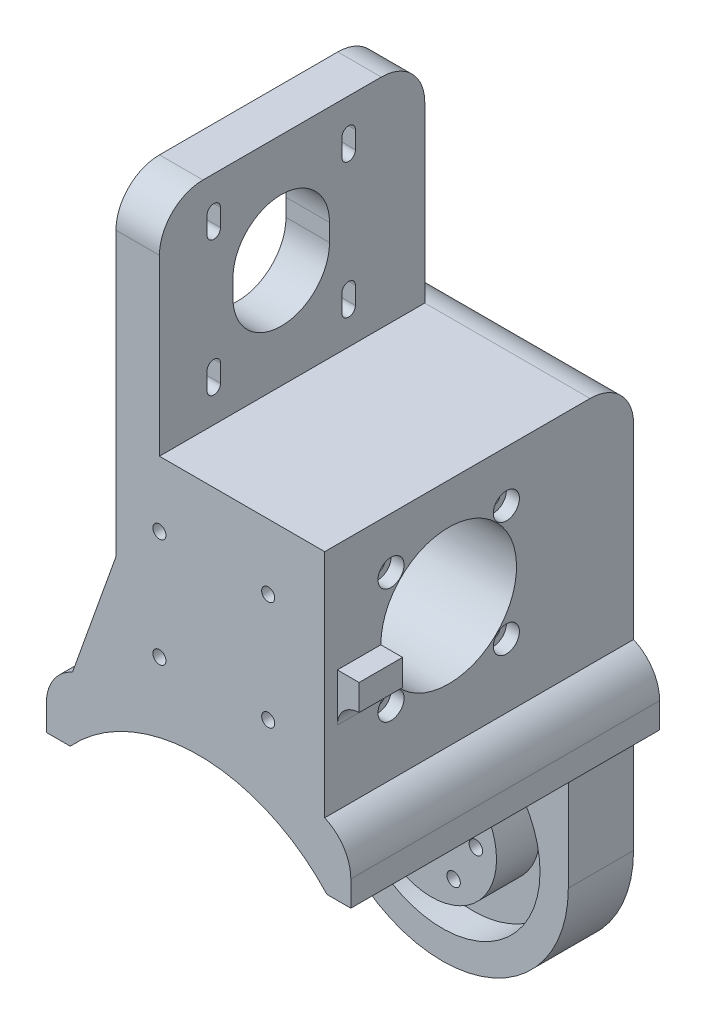
from build123d import *

# Parameters (mm, degrees)
SKETCH_1_R           = 29
EXTRUDE_1_DEPTH      = 15
SKETCH_2_R           = 1.55
SKETCH_2_R_2         = 5.1
CUT_EXTRUDE_1_DEPTH  = 44.669211122
EXTRUDE_2_DEPTH      = 71
SKETCH_12_W          = 70
SKETCH_12_H          = 15
EXTRUDE_3_DEPTH      = 71
FILLET_5_R           = 10
SKETCH_22_W          = 71
SKETCH_22_H          = 103
CUT_EXTRUDE_11_DEPTH = 10
SKETCH_4_R           = 40
CUT_EXTRUDE_2_DEPTH  = 56
SKETCH_5_R           = 15.6
SKETCH_5_R_2         = 1.55
CUT_EXTRUDE_3_DEPTH  = 171.241005636
SKETCH_6_W           = 32.2
SKETCH_6_H           = 32.2
CUT_EXTRUDE_4_DEPTH  = 23.7
CUT_EXTRUDE_5_DEPTH  = 171.241005636
SKETCH_8_W           = 10
SKETCH_8_H           = 50
CUT_EXTRUDE_6_DEPTH  = 10
FILLET_1_R           = 10
FILLET_2_R           = 10
FILLET_3_R           = 10
SKETCH_17_R          = 22.5
CUT_EXTRUDE_7_DEPTH  = 7
SKETCH_18_R          = 24
CUT_EXTRUDE_8_DEPTH  = 0.5
EXTRUDE_START        = 10
SKETCH_19_R          = 15
SKETCH_19_R_2        = 1.55
SKETCH_19_R_3        = 5.1
EXTRUDE_5_DEPTH      = 10
SKETCH_20_R          = 3
CUT_EXTRUDE_9_DEPTH  = 3
SKETCH_23_R          = 1.5
CUT_EXTRUDE_12_DEPTH = 161.262160225
SKETCH_27_R          = 3
CUT_EXTRUDE_14_DEPTH = 3
SKETCH_28_W          = 10
SKETCH_28_H          = 6
EXTRUDE_6_DEPTH      = 5
FILLET_6_R           = 5
EXTRUDE_7_DEPTH      = 10
EXTRUDE_8_DEPTH      = 6


# Some blends are built 0.0001 mm under size
with BuildPart() as part:
    # 草图1 → 凸台-拉伸1 (new body)
    with BuildSketch(Plane.XY):
        Circle(SKETCH_1_R)
    extrude(amount=EXTRUDE_1_DEPTH)

    # 草图2 → 切除-拉伸1 (cut, through all)
    with BuildSketch(Plane.XY.offset(15)):
        with Locations((-5.125, 8.876760389)):
            Circle(SKETCH_2_R)
        with Locations((5.125, 8.876760389)):
            Circle(SKETCH_2_R)
        with Locations((10.25, 0)):
            Circle(SKETCH_2_R)
        with Locations((5.125, -8.876760389)):
            Circle(SKETCH_2_R)
        Circle(SKETCH_2_R_2)
        with Locations((-5.125, -8.876760389)):
            Circle(SKETCH_2_R)
        with Locations((-10.25, 0)):
            Circle(SKETCH_2_R)
    extrude(amount=-CUT_EXTRUDE_1_DEPTH, mode=Mode.SUBTRACT)

    # 草图17 → 切除-拉伸7 (cut)
    with BuildSketch(Plane.XY.offset(15)):
        Circle(SKETCH_17_R)
    extrude(amount=-CUT_EXTRUDE_7_DEPTH, mode=Mode.SUBTRACT)

    # 草图18 → 切除-拉伸8 (cut)
    with BuildSketch(Plane.XY.offset(8)):
        Circle(SKETCH_18_R)
    extrude(amount=-CUT_EXTRUDE_8_DEPTH, mode=Mode.SUBTRACT)


with BuildPart() as body_2:
    # 草图3 → 凸台-拉伸2 (new body)
    with BuildSketch(Plane.XY):
        with BuildLine():
            ThreePointArc((-29, 0), (0, 29), (29, 0))
            Line((29, 0), (29, 95))
            Line((29, 95), (-9, 95))
            Line((-9, 95), (-9, 145))
            Line((-9, 145), (-29, 145))
            Line((-29, 145), (-29, 0))
        make_face()
    extrude(amount=EXTRUDE_2_DEPTH)

    # 草图12 → 凸台-拉伸3 (add)
    with BuildSketch(Plane.XY.offset(71)):
        with Locations((0, 34.5)):
            Rectangle(SKETCH_12_W, SKETCH_12_H)
    extrude(amount=-EXTRUDE_3_DEPTH)

    # 圆角5
    # the kernel refuses this fillet: 10 mm, written as the material it takes off along each edge
    with BuildSketch(Plane(origin=(35, 42, 93.912878475), x_dir=(0, -1, 0), z_dir=(0, 0, -1))) as fillet_5_piece_1:
        with BuildLine():
            CenterArc((9.16515139, 10), FILLET_5_R, 203.578178478, 66.421821522)
            Line((0, 6), (-0.183303028, 5.92))
            ThreePointArc((-0.183303028, 5.92), (-0.2, 3), (-0.2, 0))
            Line((-0.2, 0), (0, -0.2))
            Line((0, -0.2), (9.16515139, -0.2))
            Line((9.16515139, -0.2), (9.16515139, 0))
        make_face()
    extrude(amount=116.82575695, mode=Mode.SUBTRACT)
    with BuildSketch(Plane(origin=(-35, 42, 93.912878475), x_dir=(0, -1, 0), z_dir=(0, 0, -1))) as fillet_5_piece_2:
        with BuildLine():
            CenterArc((9.16515139, -10), FILLET_5_R, 90, 66.421821522)
            Line((0, -6), (-0.183303028, -5.92))
            ThreePointArc((-0.183303028, -5.92), (-0.2, -3), (-0.2, 0))
            Line((-0.2, 0), (0, 0.2))
            Line((0, 0.2), (9.16515139, 0.2))
            Line((9.16515139, 0.2), (9.16515139, 0))
        make_face()
    extrude(amount=116.82575695, mode=Mode.SUBTRACT)

    # 草图22 → 切除-拉伸11 (cut)
    with BuildSketch(Plane.ZY.offset(29)):
        with Locations((35.5, 93.5)):
            Rectangle(SKETCH_22_W, SKETCH_22_H)
    extrude(amount=-CUT_EXTRUDE_11_DEPTH, mode=Mode.SUBTRACT)

    # 草图4 → 切除-拉伸2 (cut)
    with BuildSketch(Plane.XY.offset(71)):
        Circle(SKETCH_4_R)
    extrude(amount=-CUT_EXTRUDE_2_DEPTH, mode=Mode.SUBTRACT)

    # 草图5 → 切除-拉伸3 (cut, through all)
    with BuildSketch(Plane.ZY.offset(19)):
        with Locations(Location((42.5, 70, 0), (0, 0, 270))):
            Circle(SKETCH_5_R)
        with Locations(Location((29.241747853, 83.258252147, 0), (0, 0, 270))):
            Circle(SKETCH_5_R_2)
        with Locations(Location((55.758252147, 83.258252147, 0), (0, 0, 270))):
            Circle(SKETCH_5_R_2)
        with Locations(Location((55.758252147, 56.741747853, 0), (0, 0, 270))):
            Circle(SKETCH_5_R_2)
        with Locations(Location((29.241747853, 56.741747853, 0), (0, 0, 270))):
            Circle(SKETCH_5_R_2)
    extrude(amount=-CUT_EXTRUDE_3_DEPTH, mode=Mode.SUBTRACT)

    # 草图6 → 切除-拉伸4 (cut)
    with BuildSketch(Plane.ZY.offset(19)):
        with Locations((42.5, 70)):
            Rectangle(SKETCH_6_W, SKETCH_6_H)
    extrude(amount=-CUT_EXTRUDE_4_DEPTH, mode=Mode.SUBTRACT)

    # 草图7 → 切除-拉伸5 (cut, through all)
    with BuildSketch(Plane.ZY.offset(19)):
        with BuildLine():
            Line((56.95, 137.497499937), (56.95, 133.497499937))
            ThreePointArc((56.95, 133.497499937), (58.5, 131.947499937), (60.05, 133.497499937))
            Line((60.05, 133.497499937), (60.05, 137.497499937))
            ThreePointArc((60.05, 137.497499937), (58.5, 139.047499937), (56.95, 137.497499937))
        make_face()
        with BuildLine():
            Line((54.1, 121.997499937), (54.1, 117.997499937))
            ThreePointArc((54.1, 117.997499937), (43, 106.897499937), (31.9, 117.997499937))
            Line((31.9, 117.997499937), (31.9, 121.997499937))
            ThreePointArc((31.9, 121.997499937), (43, 133.097499937), (54.1, 121.997499937))
        make_face()
        with BuildLine():
            Line((29.05, 137.497499937), (29.05, 133.497499937))
            ThreePointArc((29.05, 133.497499937), (27.5, 131.947499937), (25.95, 133.497499937))
            Line((25.95, 133.497499937), (25.95, 137.497499937))
            ThreePointArc((25.95, 137.497499937), (27.5, 139.047499937), (29.05, 137.497499937))
        make_face()
        with BuildLine():
            Line((56.95, 106.497499937), (56.95, 102.497499937))
            ThreePointArc((56.95, 102.497499937), (58.5, 100.947499937), (60.05, 102.497499937))
            Line((60.05, 102.497499937), (60.05, 106.497499937))
            ThreePointArc((60.05, 106.497499937), (58.5, 108.047499937), (56.95, 106.497499937))
        make_face()
        with BuildLine():
            Line((25.95, 106.497499937), (25.95, 102.497499937))
            ThreePointArc((25.95, 102.497499937), (27.5, 100.947499937), (29.05, 102.497499937))
            Line((29.05, 102.497499937), (29.05, 106.497499937))
            ThreePointArc((29.05, 106.497499937), (27.5, 108.047499937), (25.95, 106.497499937))
        make_face()
    extrude(amount=-CUT_EXTRUDE_5_DEPTH, mode=Mode.SUBTRACT)

    # 草图8 → 切除-拉伸6 (cut)
    with BuildSketch(Plane(origin=(0, 0, 0), x_dir=(-1, 0, 0), z_dir=(0, 0, -1))):
        with Locations((14, 120)):
            Rectangle(SKETCH_8_W, SKETCH_8_H)
    extrude(amount=-CUT_EXTRUDE_6_DEPTH, mode=Mode.SUBTRACT)

    # 圆角1
    fillet_1_edges = [body_2.edges().sort_by_distance(p)[0] for p in [
        (5, 95, 0),
    ]]
    fillet(fillet_1_edges, radius=FILLET_1_R)

    # 圆角2
    fillet_2_edges = [body_2.edges().sort_by_distance(p)[0] for p in [
        (-14, 145, 10),
    ]]
    fillet(fillet_2_edges, radius=FILLET_2_R)

    # 圆角3
    fillet_3_edges = [body_2.edges().sort_by_distance(p)[0] for p in [
        (-14, 145, 71),
    ]]
    fillet(fillet_3_edges, radius=FILLET_3_R)


    add(part.part)  # 凸台-拉伸5 merges part
    # 草图19 → 凸台-拉伸5 (add)
    with BuildSketch(Plane.XY.offset(7.5).offset(EXTRUDE_START)):
        Circle(SKETCH_19_R)
        with Locations((-5.125, -8.876760389)):
            Circle(SKETCH_19_R_2, mode=Mode.SUBTRACT)
        with Locations((5.125, -8.876760389)):
            Circle(SKETCH_19_R_2, mode=Mode.SUBTRACT)
        with Locations((10.25, 0)):
            Circle(SKETCH_19_R_2, mode=Mode.SUBTRACT)
        Circle(SKETCH_19_R_3, mode=Mode.SUBTRACT)
        with Locations((5.125, 8.876760389)):
            Circle(SKETCH_19_R_2, mode=Mode.SUBTRACT)
        with Locations((-5.125, 8.876760389)):
            Circle(SKETCH_19_R_2, mode=Mode.SUBTRACT)
        with Locations((-10.25, 0)):
            Circle(SKETCH_19_R_2, mode=Mode.SUBTRACT)
    extrude(amount=-EXTRUDE_5_DEPTH)

    # 草图20 → 切除-拉伸9 (cut)
    with BuildSketch(Plane(origin=(0, 0, 0), x_dir=(-1, 0, 0), z_dir=(0, 0, -1))):
        with Locations((-5.125, 8.876760389)):
            Circle(SKETCH_20_R)
        with Locations((5.125, 8.876760389)):
            Circle(SKETCH_20_R)
        with Locations((-10.25, 0)):
            Circle(SKETCH_20_R)
        with Locations((-5.125, -8.876760389)):
            Circle(SKETCH_20_R)
        with Locations((5.125, -8.876760389)):
            Circle(SKETCH_20_R)
        with Locations((10.25, 0)):
            Circle(SKETCH_20_R)
    extrude(amount=-CUT_EXTRUDE_9_DEPTH, mode=Mode.SUBTRACT)

    # 草图23 → 切除-拉伸12 (cut, through all)
    with BuildSketch(Plane(origin=(0, 0, 58.6), x_dir=(-1, 0, 0), z_dir=(0, 0, -1))):
        with Locations((-16, 80)):
            Circle(SKETCH_23_R)
        with Locations((9, 80)):
            Circle(SKETCH_23_R)
        with Locations((9, 55)):
            Circle(SKETCH_23_R)
        with Locations((-16, 55)):
            Circle(SKETCH_23_R)
    extrude(amount=-CUT_EXTRUDE_12_DEPTH, mode=Mode.SUBTRACT)

    # 草图27 → 切除-拉伸14 (cut)
    with BuildSketch(Plane(origin=(29, 0, 0), x_dir=(0, 0, -1), z_dir=(1, 0, 0))):
        with Locations((-55.758252147, 83.258252147)):
            Circle(SKETCH_27_R)
        with Locations((-29.241747853, 83.258252147)):
            Circle(SKETCH_27_R)
        with Locations((-55.758252147, 56.741747853)):
            Circle(SKETCH_27_R)
        with Locations((-29.241747853, 56.741747853)):
            Circle(SKETCH_27_R)
    extrude(amount=-CUT_EXTRUDE_14_DEPTH, mode=Mode.SUBTRACT)

    # 草图28 → 凸台-拉伸6 (add)
    with BuildSketch(Plane(origin=(29, 0, 0), x_dir=(0, 0, -1), z_dir=(1, 0, 0))):
        with Locations((-63.1, 67)):
            Rectangle(SKETCH_28_W, SKETCH_28_H)
    extrude(amount=EXTRUDE_6_DEPTH)

    # 圆角6
    fillet_6_edges = [body_2.edges().sort_by_distance(p)[0] for p in [
        (29, 64, 63.1),
    ]]
    fillet(fillet_6_edges, radius=FILLET_6_R - 0.0001)  # a hair under: the kernel refuses the full size

    # 草图29 → 凸台-拉伸7 (add)
    with BuildSketch(Plane(origin=(0, 0, 0), x_dir=(-1, 0, 0), z_dir=(0, 0, -1))):
        Polygon((19, 70), (29, 42), (19, 42), align=None)
    extrude(amount=-EXTRUDE_7_DEPTH)

    # 草图30 → 凸台-拉伸8 (add)
    with BuildSketch(Plane.XY.offset(71)):
        Polygon((-29, 42), (-19, 70), (-19, 42), align=None)
    extrude(amount=-EXTRUDE_8_DEPTH)


solid = body_2.part
